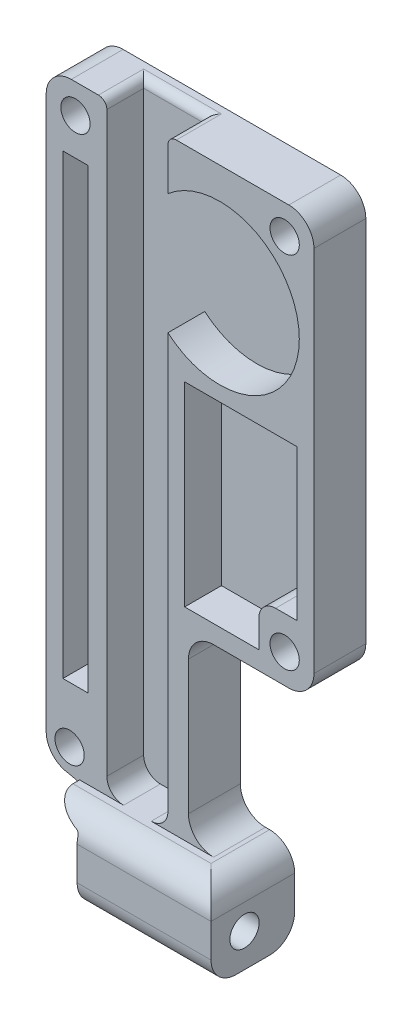
from build123d import *

# Parameters (mm, degrees)
BODY_DEPTH                      = 3.1
CHANNEL_W                       = 7.3
CHANNEL_H                       = 72
PIGIONCHANNEL_DEPTH             = 4.4
SKIZZE2_R                       = 1.75
SCREWS_DEPTH                    = 49.828144706
VERRUNDUNG1_R                   = 3
VERRUNDUNG2_R                   = 1
VERRUNDUNG3_R                   = 3
SKIZZE6_W                       = 19.5
SKIZZE6_H                       = 10
HANDLE_DEPTH                    = 10
SKIZZE7_R                       = 1.75
SCHNITT_LINEAR_AUSTRAGEN3_DEPTH = 52.800082742
SKIZZE8_W                       = 10
SKIZZE8_H                       = 8.274086909
SCHNITT_LINEAR_AUSTRAGEN4_DEPTH = 3.5
VERRUNDUNG7_R                   = 3
VERRUNDUNG8_R                   = 3
VERRUNDUNG12_R                  = 3
VERRUNDUNG13_R                  = 3
VERRUNDUNG14_R                  = 3
VERRUNDUNG16_R                  = 2
SKIZZE9_R                       = 9.5
GEAR_CAGE_DEPTH                 = 4.4
SCHNITT_LINEAR_AUSTRAGEN6_DEPTH = 4.4
VERRUNDUNG17_R                  = 2
SKIZZE11_W                      = 3
SKIZZE11_H                      = 54.597729832
SCHNITT_LINEAR_AUSTRAGEN7_DEPTH = 4.4
VERRUNDUNG18_R                  = 3
VERRUNDUNG19_R                  = 0.5
VERRUNDUNG20_START              = -4
VERRUNDUNG20_DEPTH              = 10.628110602
VERRUNDUNG22_START              = -3.1
VERRUNDUNG22_DEPTH              = 6.2


with BuildPart() as part:
    # body_sketch → body (new, symmetric)
    with BuildSketch(Plane.XY):
        Polygon((0, -35.644151565), (0, 36.355848435), (32, 36.355848435), (32, -13.644151565), (17, -13.644151565), (17, -35.644151565), align=None)
    extrude(amount=BODY_DEPTH, both=True)

    # channel → pigionchannel (cut)
    with BuildSketch(Plane.XY.offset(3.1)):
        with Locations((10.9, 0.355848435)):
            Rectangle(CHANNEL_W, CHANNEL_H)
    extrude(amount=-PIGIONCHANNEL_DEPTH, mode=Mode.SUBTRACT)

    # Skizze2 → screws (cut, through all)
    with BuildSketch(Plane.XY.offset(3.1)):
        with Locations((3.5, 32.855848435)):
            Circle(SKIZZE2_R)
        with Locations((28.5, 32.855848435)):
            Circle(SKIZZE2_R)
        with Locations((28.5, -10.144151565)):
            Circle(SKIZZE2_R)
        with Locations((2.8, -32.844151565)):
            Circle(SKIZZE2_R)
    extrude(amount=-SCREWS_DEPTH, mode=Mode.SUBTRACT)

    # Verrundung1
    verrundung1_edges = [part.edges().sort_by_distance(p)[0] for p in [
        (0, 36.355848435, 0),
        (32, 36.355848435, 0),
    ]]
    fillet(verrundung1_edges, radius=VERRUNDUNG1_R)

    # Verrundung2
    verrundung2_edges = [part.edges().sort_by_distance(p)[0] for p in [
        (14.55, 36.355848435, 0.9),
        (10.9, 36.355848435, -1.3),
        (7.25, 36.355848435, 0.9),
    ]]
    fillet(verrundung2_edges, radius=VERRUNDUNG2_R)

    # Verrundung3
    verrundung3_edges = [part.edges().sort_by_distance(p)[0] for p in [
        (32, -13.644151565, 0),
    ]]
    fillet(verrundung3_edges, radius=VERRUNDUNG3_R)

    # Skizze6 → handle (add)
    with BuildSketch(Plane.XZ.offset(35.644151565)):
        with Locations((13.75, 1.9)):
            Rectangle(SKIZZE6_W, SKIZZE6_H)
    extrude(amount=HANDLE_DEPTH)

    # Skizze7 → Schnitt-Linear austragen3 (cut, through all)
    with BuildSketch(Plane(origin=(23.5, 0, 0), x_dir=(0, 0, -1), z_dir=(1, 0, 0))):
        with Locations((-2.9, -41.644151565)):
            Circle(SKIZZE7_R)
    extrude(amount=-SCHNITT_LINEAR_AUSTRAGEN3_DEPTH, mode=Mode.SUBTRACT)

    # Skizze8 → Schnitt-Linear austragen4 (cut)
    with BuildSketch(Plane.ZY.offset(-4)):
        with Locations((1.9, -41.50710811)):
            Rectangle(SKIZZE8_W, SKIZZE8_H)
    extrude(amount=-SCHNITT_LINEAR_AUSTRAGEN4_DEPTH, mode=Mode.SUBTRACT)

    # Verrundung7
    verrundung7_edges = [part.edges().sort_by_distance(p)[0] for p in [
        (15.5, -45.644151565, 6.9),
    ]]
    fillet(verrundung7_edges, radius=VERRUNDUNG7_R)

    # Verrundung8
    verrundung8_edges = [part.edges().sort_by_distance(p)[0] for p in [
        (15.5, -45.644151565, -3.1),
    ]]
    fillet(verrundung8_edges, radius=VERRUNDUNG8_R)

    # Verrundung12
    verrundung12_edges = [part.edges().sort_by_distance(p)[0] for p in [
        (17, -13.644151565, 0),
    ]]
    fillet(verrundung12_edges, radius=VERRUNDUNG12_R)

    # Verrundung13
    verrundung13_edges = [part.edges().sort_by_distance(p)[0] for p in [
        (17, -35.644151565, 0),
    ]]
    fillet(verrundung13_edges, radius=VERRUNDUNG13_R)

    # Verrundung14
    verrundung14_edges = [part.edges().sort_by_distance(p)[0] for p in [
        (0, -35.644151565, 0),
    ]]
    fillet(verrundung14_edges, radius=VERRUNDUNG14_R)

    # Verrundung16
    verrundung16_edges = [part.edges().sort_by_distance(p)[0] for p in [
        (14.55, -35.644151565, 0.9),
        (7.25, -35.644151565, 0.9),
    ]]
    fillet(verrundung16_edges, radius=VERRUNDUNG16_R)

    # Skizze9 → gear cage (cut)
    with BuildSketch(Plane.XY.offset(3.1)):
        with Locations((20.75, 23.105848435)):
            Circle(SKIZZE9_R)
    extrude(amount=-GEAR_CAGE_DEPTH, mode=Mode.SUBTRACT)

    # Skizze10 → Schnitt-Linear austragen6 (cut)
    with BuildSketch(Plane.XY.offset(3.1)):
        Polygon((16.55, 11.83128846), (30, 11.83128846), (30, -6.16871154), (25.418135465, -6.16871154), (25.418135465, -11.465988975), (16.55, -11.465988975), align=None)
    extrude(amount=-SCHNITT_LINEAR_AUSTRAGEN6_DEPTH, mode=Mode.SUBTRACT)

    # Verrundung17
    verrundung17_edges = [part.edges().sort_by_distance(p)[0] for p in [
        (25.418135465, -6.16871154, 0.9),
    ]]
    fillet(verrundung17_edges, radius=VERRUNDUNG17_R)

    # Skizze11 → Schnitt-Linear austragen7 (cut)
    with BuildSketch(Plane.XY.offset(3.1)):
        with Locations((3.5, 1.149247054)):
            Rectangle(SKIZZE11_W, SKIZZE11_H)
    extrude(amount=-SCHNITT_LINEAR_AUSTRAGEN7_DEPTH, mode=Mode.SUBTRACT)

    # Verrundung18
    verrundung18_edges = [part.edges().sort_by_distance(p)[0] for p in [
        (13.75, -35.644151565, 6.9),
        (23.5, -35.644151565, 1.9),
    ]]
    fillet(verrundung18_edges, radius=VERRUNDUNG18_R)

    # Verrundung19
    verrundung19_edges = [part.edges().sort_by_distance(p)[0] for p in [
        (7.5, -37.370064656, 1.758004285),
    ]]
    fillet(verrundung19_edges, radius=VERRUNDUNG19_R)

    # Verrundung20: read off the stored shape, not the designer's step
    # Verrundung20 outline → Verrundung20 (cut)
    with BuildSketch(Plane.XY.offset(VERRUNDUNG20_START)):
        with BuildLine():
            ThreePointArc((7, -37.370064656), (7.080813571, -37.376638707), (7.159502052, -37.396187989))
            ThreePointArc((7.159502052, -37.396187989), (5.499970333, -36.664033092), (3.999994229, -35.644146822))
            Line((3.999994229, -35.644146822), (4, -37.370064656))
            Line((4, -37.370064656), (7, -37.370064656))
        make_face()
    extrude(amount=VERRUNDUNG20_DEPTH, mode=Mode.SUBTRACT)

    # Verrundung22: read off the stored shape, not the designer's step
    # Verrundung22 outline → Verrundung22 (add)
    with BuildSketch(Plane.XY.offset(VERRUNDUNG22_START)):
        with BuildLine():
            ThreePointArc((2.557893696, -35.611396418), (4.007665984, -35.968268897), (5.36587668, -36.588318377))
            ThreePointArc((5.36587668, -36.588318377), (4.663304696, -36.144631367), (3.999994229, -35.644146822))
            Line((3.999994229, -35.644146822), (3, -35.644151565))
            ThreePointArc((3, -35.644151565), (2.778340981, -35.635951572), (2.557893696, -35.611396418))
        make_face()
    extrude(amount=VERRUNDUNG22_DEPTH)


solid = part.part
